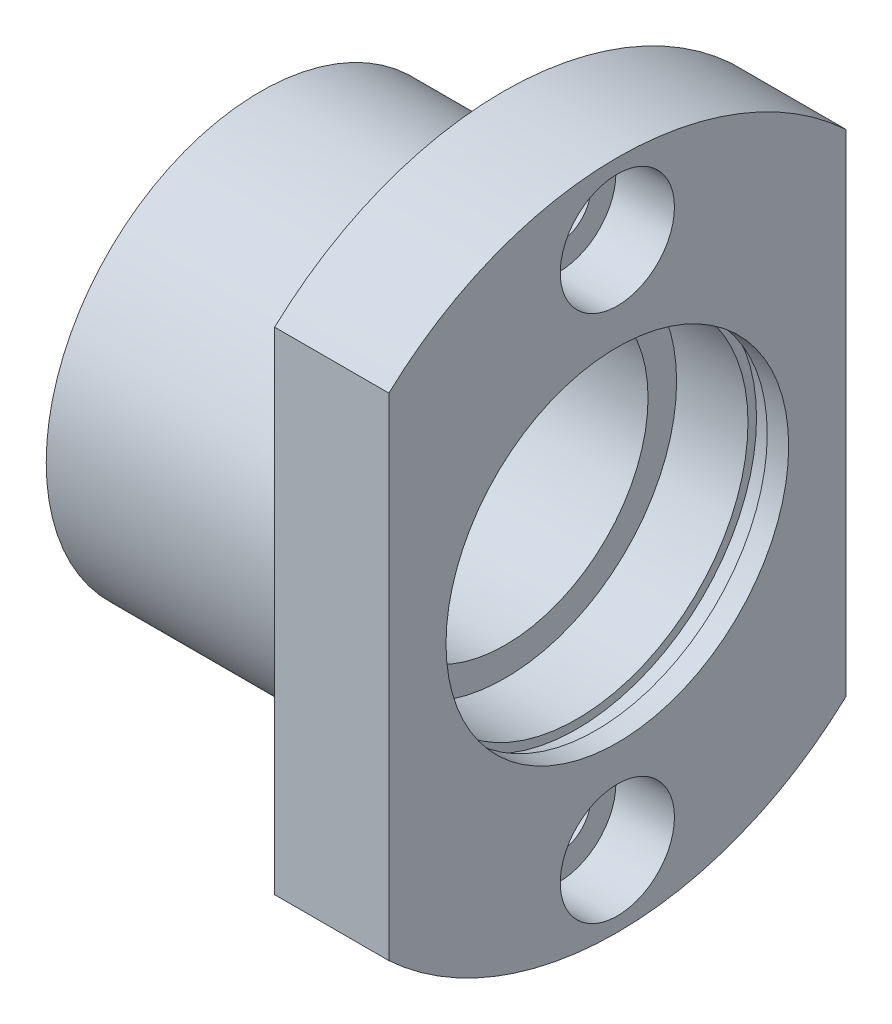
from build123d import *

# Parameters (mm, degrees)
CBORE_SOCKET_HEAD_CAP_SCREW1_D           = 4.5
CBORE_SOCKET_HEAD_CAP_SCREW1_CBORE_D     = 8
CBORE_SOCKET_HEAD_CAP_SCREW1_CBORE_DEPTH = 4.1
DELETEFACE1_START                        = 17
DELETEFACE1_OUTLINE_R                    = 4
DELETEFACE1_DEPTH                        = 8
CUT_EXTRUDE2_DEPTH                       = 38.32961291
CBORE_SOCKET_HEAD_CAP_SCREW2_D           = 4.5
CBORE_SOCKET_HEAD_CAP_SCREW2_CBORE_D     = 8
CBORE_SOCKET_HEAD_CAP_SCREW2_CBORE_DEPTH = 4.1


# Read off the part's stored shape, not the designer's step: DeleteFace1
with BuildPart() as part:
    # Sketch1 → Revolve1 (revolve)
    with BuildSketch(Plane.XY, mode=Mode.PRIVATE) as revolve1_sk:
        Polygon((25, 12), (25, 23.5), (17, 23.5), (17, 15), (0, 15), (0, 12), (1.5, 12), (1.5, 12.6), (2.85, 12.6), (2.85, 12), (7.85, 12), (7.85, 10), (17.15, 10), (17.15, 12), (22.15, 12), (22.15, 12.6), (23.5, 12.6), (23.5, 12), align=None)
    revolve(revolve1_sk.sketch.rotate(Axis((25, 0, 0), (-1, 0, 0)), 90), axis=Axis((25, 0, 0), (-1, 0, 0)))

    # CBORE Socket Head Cap Screw1 (through all)
    with Locations(Plane(origin=(25, 0, 0), x_dir=(0, 0, -1), z_dir=(1, 0, 0))):
        with Locations((0, 18.5), (18.5, 0), (-18.5, 0), (0, -18.5)):
            CounterBoreHole(CBORE_SOCKET_HEAD_CAP_SCREW1_D / 2, CBORE_SOCKET_HEAD_CAP_SCREW1_CBORE_D / 2, CBORE_SOCKET_HEAD_CAP_SCREW1_CBORE_DEPTH)

    # DeleteFace1 outline → DeleteFace1 (add)
    with BuildSketch(Plane.YZ.offset(DELETEFACE1_START)):
        with Locations((-18.5, 0)):
            Circle(DELETEFACE1_OUTLINE_R)
        with Locations((0, 18.5)):
            Circle(DELETEFACE1_OUTLINE_R)
        with Locations((0, -18.5)):
            Circle(DELETEFACE1_OUTLINE_R)
        with Locations((18.5, 0)):
            Circle(DELETEFACE1_OUTLINE_R)
    extrude(amount=DELETEFACE1_DEPTH)

    # Sketch5 → Cut-Extrude2 (cut, through all)
    with BuildSketch(Plane(origin=(17, 0, 0), x_dir=(0, 0, -1), z_dir=(1, 0, 0))):
        with BuildLine():
            Line((-16, 17.211914478), (-16, -17.211914478))
            ThreePointArc((-16, -17.211914478), (-23.5, 0), (-16, 17.211914478))
        make_face()
        with BuildLine():
            Line((16, 17.211914478), (16, -17.211914478))
            ThreePointArc((16, -17.211914478), (23.5, 0), (16, 17.211914478))
        make_face()
    extrude(amount=CUT_EXTRUDE2_DEPTH, mode=Mode.SUBTRACT)

    # CBORE Socket Head Cap Screw2 (through all)
    with Locations(Plane(origin=(25, 0, 0), x_dir=(0, 0, -1), z_dir=(1, 0, 0))):
        with Locations((0, 18.5), (0, -18.5)):
            CounterBoreHole(CBORE_SOCKET_HEAD_CAP_SCREW2_D / 2, CBORE_SOCKET_HEAD_CAP_SCREW2_CBORE_D / 2, CBORE_SOCKET_HEAD_CAP_SCREW2_CBORE_DEPTH)


solid = part.part
